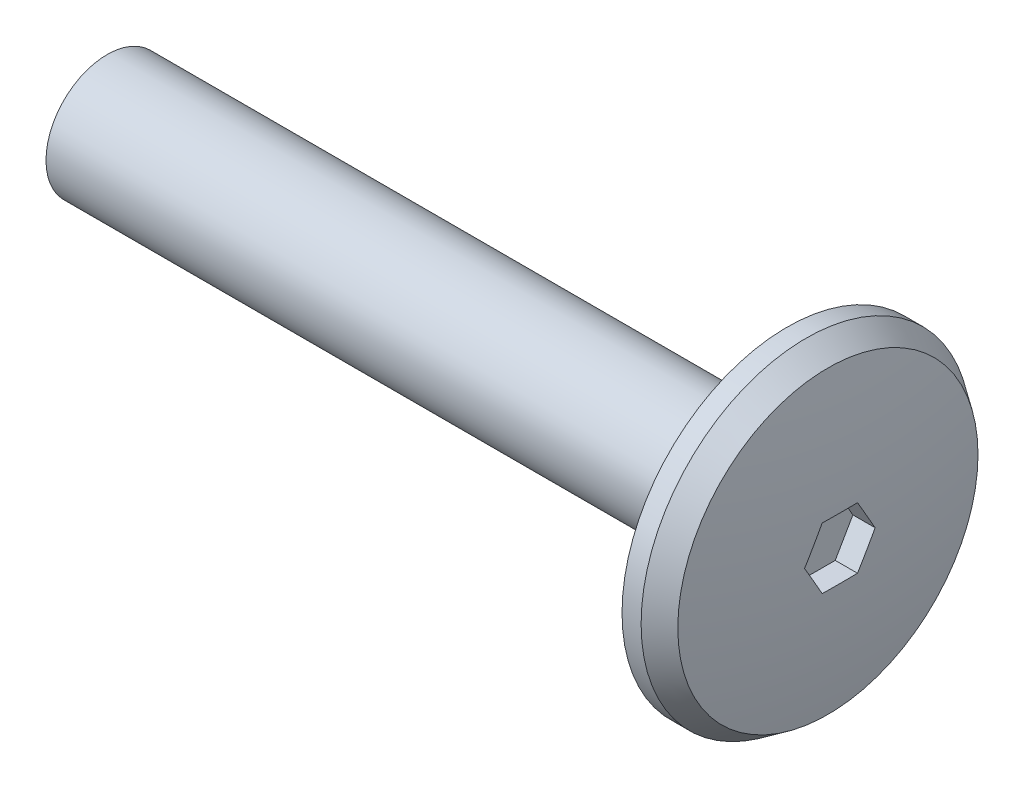
from build123d import *

# Parameters (mm, degrees)
M6_TAPPED_HOLE1_D     = 5
M6_TAPPED_HOLE1_DEPTH = 20
M6_TAPPED_HOLE1_TIP   = 1.502151548
CHAMFER1_SIZE         = 1.25095704
SKETCH8_R             = 10.8
SKETCH8_R_2           = 6
CUT_EXTRUDE2_DEPTH    = 0.5
CHAMFER2_SIZE         = 0.5
CUT_EXTRUDE3_START    = -2
CUT_EXTRUDE3_DEPTH    = 46.048166808


# Some blends are built 0.0001 mm under size
with BuildPart() as part:
    # Sketch1 → Revolve1 (revolve)
    with BuildSketch(Plane.XY, mode=Mode.PRIVATE) as revolve1_sk:
        with BuildLine():
            Line((0, 0), (48, 0))
            ThreePointArc((48, 0), (47.749466448, 5.423098745), (47, 10.8))
            Line((47, 10.8), (44, 10.8))
            Line((44, 10.8), (44, 4))
            Line((44, 4), (0, 4))
            Line((0, 4), (0, 0))
        make_face()
    revolve(revolve1_sk.sketch.rotate(Axis((0, 0, 0), (1, 0, 0)), 90), axis=Axis((0, 0, 0), (1, 0, 0)))

    # M6 Tapped Hole1
    with Locations(Plane.ZY):
        with Locations((0, 0)):
            Hole(M6_TAPPED_HOLE1_D / 2, depth=M6_TAPPED_HOLE1_DEPTH)
            with Locations((0, 0, -(M6_TAPPED_HOLE1_DEPTH + M6_TAPPED_HOLE1_TIP / 2))):  # 118° drill point
                Cone(0, M6_TAPPED_HOLE1_D / 2, M6_TAPPED_HOLE1_TIP, mode=Mode.SUBTRACT)

    # Chamfer1
    # the kernel refuses this chamfer: 1.25095704, 1 mm, written as the material it takes off along each edge
    with BuildSketch(Plane(origin=(47, 0, 0), x_dir=(0, 0, 1), z_dir=(0, 1, 0))) as chamfer1_piece_1:
        with BuildLine():
            Line((9.823683565, 0.173858651), (10.8, -CHAMFER1_SIZE))
            Line((10.8, -CHAMFER1_SIZE), (10.8, 0))
            ThreePointArc((10.8, 0), (10.294942592, 0.092058822), (9.823683565, 0.173858651))
        make_face()
    revolve(axis=Axis((47, 0, 0), (1, 0, 0)), mode=Mode.SUBTRACT)

    # Sketch8 → Cut-Extrude2 (cut)
    with BuildSketch(Plane.ZY.offset(-44)):
        Circle(SKETCH8_R)
        Circle(SKETCH8_R_2, mode=Mode.SUBTRACT)
    extrude(amount=-CUT_EXTRUDE2_DEPTH, mode=Mode.SUBTRACT)

    # Chamfer2
    chamfer2_edges = [part.edges().sort_by_distance(p)[0] for p in [
        (44, 0, -6),
    ]]
    chamfer(chamfer2_edges, length=CHAMFER2_SIZE - 0.0001)  # a hair under: the kernel refuses the full size

    # Sketch9 → Cut-Extrude3 (cut, through all)
    with BuildSketch(Plane.ZY.offset(-44.5).offset(CUT_EXTRUDE3_START)):
        Polygon((1.154700538, -2), (2.309401077, 0), (1.154700538, 2), (-1.154700538, 2), (-2.309401077, 0), (-1.154700538, -2), align=None)
    extrude(amount=-CUT_EXTRUDE3_DEPTH, mode=Mode.SUBTRACT)


solid = part.part
